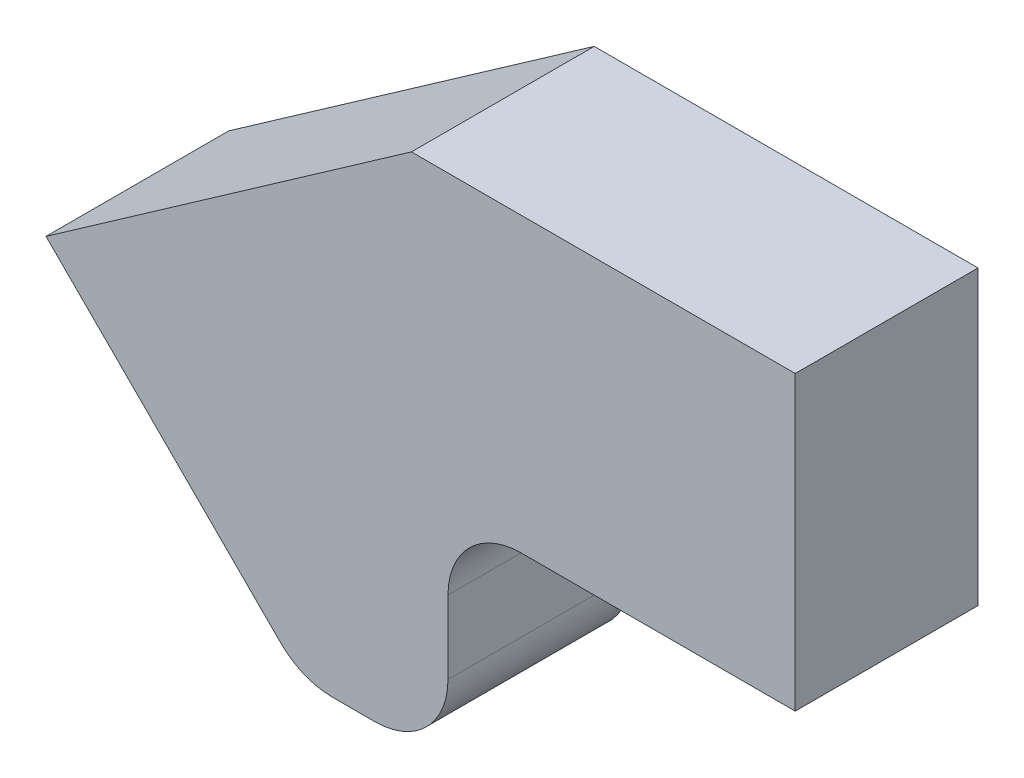
from build123d import *

# Parameters (mm, degrees)
BOSS_EXTRUDE1_DEPTH = 0.125
FILLET1_R           = 0.1


with BuildPart() as part:
    # frame_outline → Boss-Extrude1 (new, symmetric)
    with BuildSketch(Plane.XY):
        Polygon((0, 0), (0.499851802, 0.35), (1.024851802, 0.35), (1.024851802, -0.05), (0.549851802, -0.05), (0.549851802, -0.35), (0.35, -0.35), align=None)
    extrude(amount=BOSS_EXTRUDE1_DEPTH, both=True)

    # Fillet1
    fillet1_edges = [part.edges().sort_by_distance(p)[0] for p in [
        (0.549851802, -0.35, 0),
        (0.549851802, -0.05, 0),
        (0.35, -0.35, 0),
    ]]
    fillet(fillet1_edges, radius=FILLET1_R)


solid = part.part
